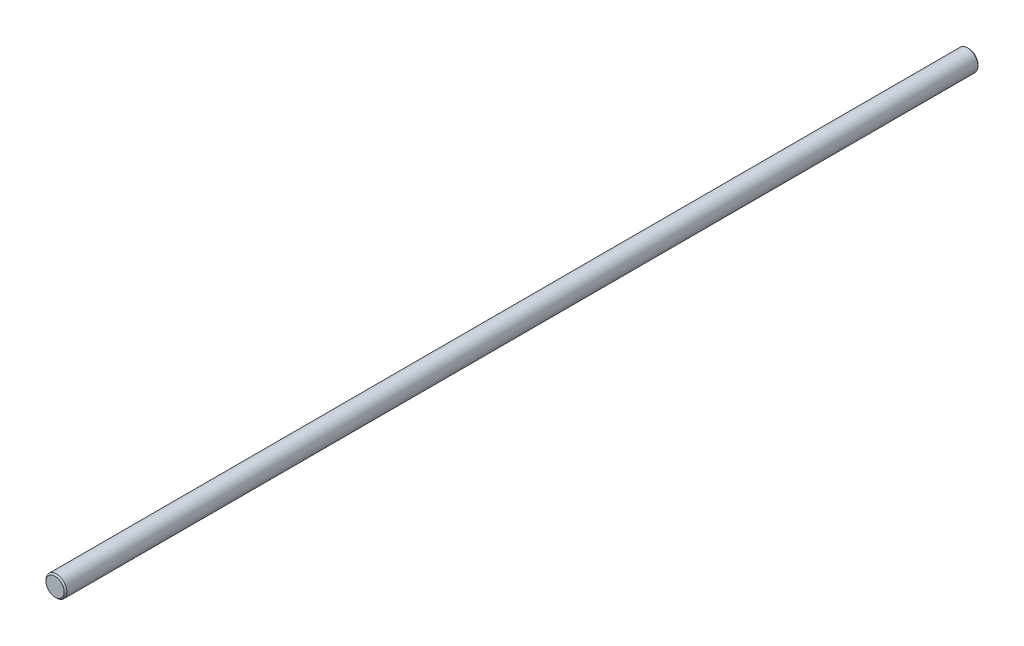
from build123d import *

# Parameters (mm, degrees)
SKETCH1_R           = 4
BOSS_EXTRUDE1_DEPTH = 350
CHAMFER1_SIZE       = 0.5


with BuildPart() as part:
    # Sketch1 → Boss-Extrude1 (new body)
    with BuildSketch(Plane.XY):
        Circle(SKETCH1_R)
    extrude(amount=-BOSS_EXTRUDE1_DEPTH)

    # Chamfer1
    chamfer1_edges = [part.edges().sort_by_distance(p)[0] for p in [
        (-4, 0, -350),
        (-4, 0, 0),
    ]]
    chamfer(chamfer1_edges, length=CHAMFER1_SIZE)


solid = part.part
